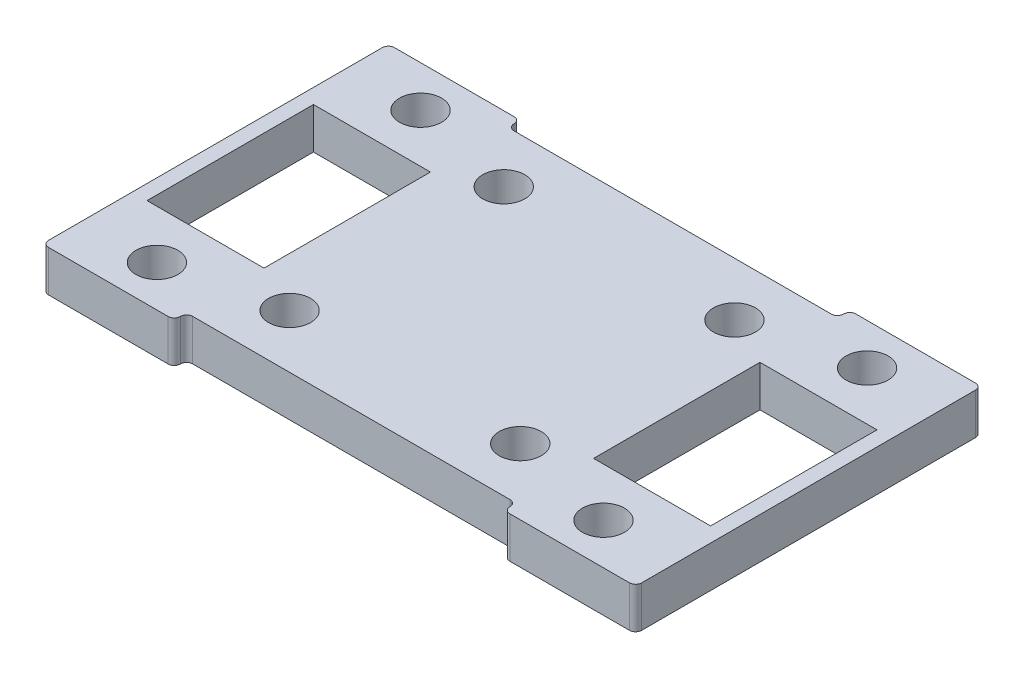
from build123d import *

# Parameters (mm, degrees)
SKETCH1_R           = 2.55
SKETCH1_W           = 14.2
SKETCH1_H           = 20.2
BOSS_EXTRUDE1_DEPTH = 5


with BuildPart() as part:
    # Sketch1 → Boss-Extrude1 (new body)
    with BuildSketch(Plane(origin=(0, 0, 0), x_dir=(1, 0, 0), z_dir=(0, 1, 0))):
        with BuildLine():
            Line((-19.26, -19.5), (19.26, -19.5))
            ThreePointArc((19.26, -19.5), (19.783259018, -19.716740982), (20, -20.24))
            Line((20, -20.24), (20, -20.26))
            ThreePointArc((20, -20.26), (20.216740982, -20.783259018), (20.74, -21))
            Line((20.74, -21), (35.26, -21))
            ThreePointArc((35.26, -21), (35.783259018, -20.783259018), (36, -20.26))
            Line((36, -20.26), (36, 20.26))
            ThreePointArc((36, 20.26), (35.783259018, 20.783259018), (35.26, 21))
            Line((35.26, 21), (20.74, 21))
            ThreePointArc((20.74, 21), (20.216740982, 20.783259018), (20, 20.26))
            Line((20, 20.26), (20, 20.24))
            ThreePointArc((20, 20.24), (19.783259018, 19.716740982), (19.26, 19.5))
            Line((19.26, 19.5), (-19.26, 19.5))
            ThreePointArc((-19.26, 19.5), (-19.783259018, 19.716740982), (-20, 20.24))
            Line((-20, 20.24), (-20, 20.26))
            ThreePointArc((-20, 20.26), (-20.216740982, 20.783259018), (-20.74, 21))
            Line((-20.74, 21), (-35.26, 21))
            ThreePointArc((-35.26, 21), (-35.783259018, 20.783259018), (-36, 20.26))
            Line((-36, 20.26), (-36, -20.26))
            ThreePointArc((-36, -20.26), (-35.783259018, -20.783259018), (-35.26, -21))
            Line((-35.26, -21), (-20.74, -21))
            ThreePointArc((-20.74, -21), (-20.216740982, -20.783259018), (-20, -20.26))
            Line((-20, -20.26), (-20, -20.24))
            ThreePointArc((-20, -20.24), (-19.783259018, -19.716740982), (-19.26, -19.5))
        make_face()
        with Locations((-14, 13)):
            Circle(SKETCH1_R, mode=Mode.SUBTRACT)
        with Locations((14, 13)):
            Circle(SKETCH1_R, mode=Mode.SUBTRACT)
        with Locations((14, -13)):
            Circle(SKETCH1_R, mode=Mode.SUBTRACT)
        with Locations((-14, -13)):
            Circle(SKETCH1_R, mode=Mode.SUBTRACT)
        with Locations((27.1, 16)):
            Circle(SKETCH1_R, mode=Mode.SUBTRACT)
        with Locations((27.1, -16)):
            Circle(SKETCH1_R, mode=Mode.SUBTRACT)
        with Locations((-27.1, -16)):
            Circle(SKETCH1_R, mode=Mode.SUBTRACT)
        with Locations((-27.1, 16)):
            Circle(SKETCH1_R, mode=Mode.SUBTRACT)
        with Locations((27.1, 0)):
            Rectangle(SKETCH1_W, SKETCH1_H, mode=Mode.SUBTRACT)
        with Locations((-27.1, 0)):
            Rectangle(SKETCH1_W, SKETCH1_H, mode=Mode.SUBTRACT)
    extrude(amount=BOSS_EXTRUDE1_DEPTH)


solid = part.part
